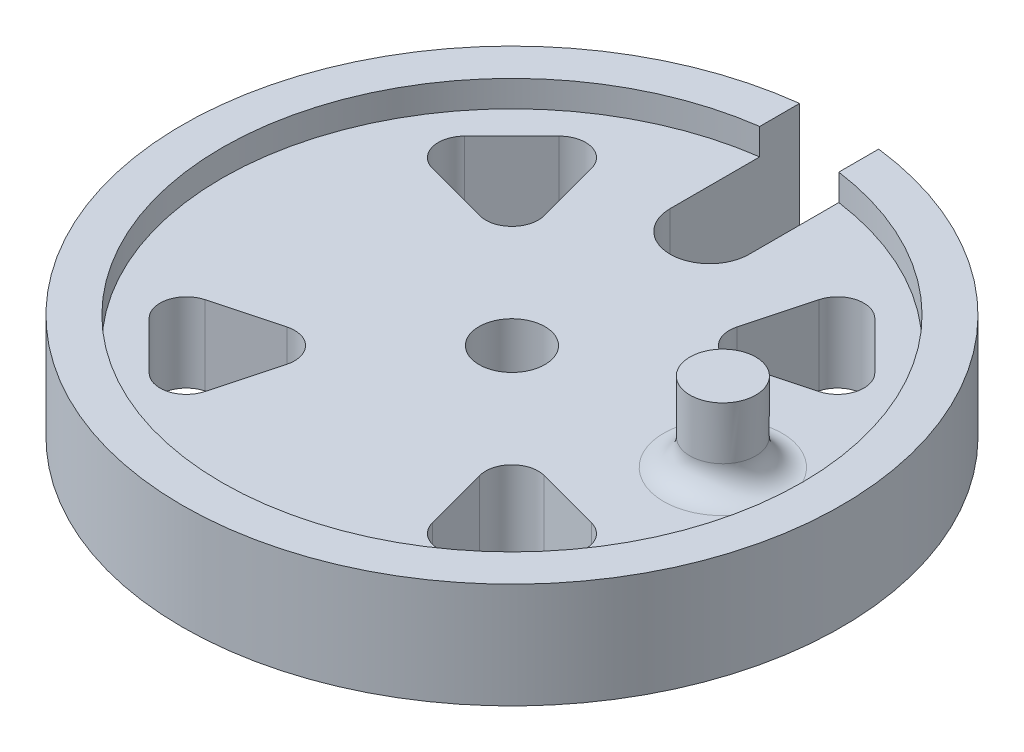
from build123d import *

# Parameters (mm, degrees)
SKETCH1_R           = 31.75
BOSS_EXTRUDE3_DEPTH = 10.16
SKETCH3_R           = 27.94
CUT_EXTRUDE1_DEPTH  = 2.54
SKETCH4_R           = 3.175
CUT_EXTRUDE2_DEPTH  = 46.543269536
CUT_EXTRUDE3_DEPTH  = 46.543269536
CUT_EXTRUDE4_DEPTH  = 46.543269536
FILLET1_R           = 2.54


with BuildPart() as part:
    # Sketch1 → Boss-Extrude3 (new body)
    with BuildSketch(Plane(origin=(0, 0, 0), x_dir=(1, 0, 0), z_dir=(0, 1, 0))):
        with Locations(Location((0, 0, 0), (0, 0, 270))):
            Circle(SKETCH1_R)
    extrude(amount=BOSS_EXTRUDE3_DEPTH)

    # Sketch3 → Cut-Extrude1 (cut)
    with BuildSketch(Plane(origin=(0, 10.16, 0), x_dir=(1, 0, 0), z_dir=(0, 1, 0))):
        with Locations(Location((0, 0, 0), (0, 0, 270))):
            Circle(SKETCH3_R)
    extrude(amount=-CUT_EXTRUDE1_DEPTH, mode=Mode.SUBTRACT)

    # Sketch4 → Cut-Extrude2 (cut, through all)
    with BuildSketch(Plane(origin=(0, 7.62, 0), x_dir=(1, 0, 0), z_dir=(0, 1, 0))):
        with Locations(Location((0, 0, 0), (0, 0, 270))):
            Circle(SKETCH4_R)
    extrude(amount=-CUT_EXTRUDE2_DEPTH, mode=Mode.SUBTRACT)

    # Sketch5 → Cut-Extrude3 (cut, through all)
    with BuildSketch(Plane(origin=(0, 7.62, 0), x_dir=(1, 0, 0), z_dir=(0, 1, 0))):
        with BuildLine():
            Line((12.39620867, 9.285356697), (18.617912617, 10.952457245))
            ThreePointArc((18.617912617, 10.952457245), (20.413963841, 12.748508469), (19.756563466, 15.201960068))
            Line((19.756563466, 15.201960068), (15.201960068, 19.756563466))
            ThreePointArc((15.201960068, 19.756563466), (12.748508469, 20.413963841), (10.952457245, 18.617912617))
            Line((10.952457245, 18.617912617), (9.285356697, 12.39620867))
            ThreePointArc((9.285356697, 12.39620867), (9.942757071, 9.942757071), (12.39620867, 9.285356697))
        make_face()
        with BuildLine():
            Line((9.285356697, -12.39620867), (10.952457245, -18.617912617))
            ThreePointArc((10.952457245, -18.617912617), (12.748508469, -20.413963841), (15.201960068, -19.756563466))
            Line((15.201960068, -19.756563466), (19.756563466, -15.201960068))
            ThreePointArc((19.756563466, -15.201960068), (20.413963841, -12.748508469), (18.617912617, -10.952457245))
            Line((18.617912617, -10.952457245), (12.39620867, -9.285356697))
            ThreePointArc((12.39620867, -9.285356697), (9.942757071, -9.942757071), (9.285356697, -12.39620867))
        make_face()
        with BuildLine():
            Line((-12.39620867, -9.285356697), (-18.617912617, -10.952457245))
            ThreePointArc((-18.617912617, -10.952457245), (-20.413963841, -12.748508469), (-19.756563466, -15.201960068))
            Line((-19.756563466, -15.201960068), (-15.201960068, -19.756563466))
            ThreePointArc((-15.201960068, -19.756563466), (-12.748508469, -20.413963841), (-10.952457245, -18.617912617))
            Line((-10.952457245, -18.617912617), (-9.285356697, -12.39620867))
            ThreePointArc((-9.285356697, -12.39620867), (-9.942757071, -9.942757071), (-12.39620867, -9.285356697))
        make_face()
        with BuildLine():
            Line((-9.285356697, 12.39620867), (-10.952457245, 18.617912617))
            ThreePointArc((-10.952457245, 18.617912617), (-12.748508469, 20.413963841), (-15.201960068, 19.756563466))
            Line((-15.201960068, 19.756563466), (-19.756563466, 15.201960068))
            ThreePointArc((-19.756563466, 15.201960068), (-20.413963841, 12.748508469), (-18.617912617, 10.952457245))
            Line((-18.617912617, 10.952457245), (-12.39620867, 9.285356697))
            ThreePointArc((-12.39620867, 9.285356697), (-9.942757071, 9.942757071), (-9.285356697, 12.39620867))
        make_face()
        with BuildLine():
            Line((-3.81, 19.05), (-3.81, 34.374285303))
            Line((-3.81, 34.374285303), (3.81, 34.374285303))
            Line((3.81, 34.374285303), (3.81, 19.05))
            ThreePointArc((3.81, 19.05), (0, 15.24), (-3.81, 19.05))
        make_face()
    extrude(amount=-CUT_EXTRUDE3_DEPTH, mode=Mode.SUBTRACT)

    # Sketch5<2> → Cut-Extrude4 (cut, through all)
    with BuildSketch(Plane(origin=(0, 7.62, 0), x_dir=(1, 0, 0), z_dir=(0, 1, 0))):
        with BuildLine():
            Line((12.39620867, 9.285356697), (18.617912617, 10.952457245))
            ThreePointArc((18.617912617, 10.952457245), (20.413963841, 12.748508469), (19.756563466, 15.201960068))
            Line((19.756563466, 15.201960068), (15.201960068, 19.756563466))
            ThreePointArc((15.201960068, 19.756563466), (12.748508469, 20.413963841), (10.952457245, 18.617912617))
            Line((10.952457245, 18.617912617), (9.285356697, 12.39620867))
            ThreePointArc((9.285356697, 12.39620867), (9.942757071, 9.942757071), (12.39620867, 9.285356697))
        make_face()
        with BuildLine():
            Line((9.285356697, -12.39620867), (10.952457245, -18.617912617))
            ThreePointArc((10.952457245, -18.617912617), (12.748508469, -20.413963841), (15.201960068, -19.756563466))
            Line((15.201960068, -19.756563466), (19.756563466, -15.201960068))
            ThreePointArc((19.756563466, -15.201960068), (20.413963841, -12.748508469), (18.617912617, -10.952457245))
            Line((18.617912617, -10.952457245), (12.39620867, -9.285356697))
            ThreePointArc((12.39620867, -9.285356697), (9.942757071, -9.942757071), (9.285356697, -12.39620867))
        make_face()
        with BuildLine():
            Line((-12.39620867, -9.285356697), (-18.617912617, -10.952457245))
            ThreePointArc((-18.617912617, -10.952457245), (-20.413963841, -12.748508469), (-19.756563466, -15.201960068))
            Line((-19.756563466, -15.201960068), (-15.201960068, -19.756563466))
            ThreePointArc((-15.201960068, -19.756563466), (-12.748508469, -20.413963841), (-10.952457245, -18.617912617))
            Line((-10.952457245, -18.617912617), (-9.285356697, -12.39620867))
            ThreePointArc((-9.285356697, -12.39620867), (-9.942757071, -9.942757071), (-12.39620867, -9.285356697))
        make_face()
        with BuildLine():
            Line((-9.285356697, 12.39620867), (-10.952457245, 18.617912617))
            ThreePointArc((-10.952457245, 18.617912617), (-12.748508469, 20.413963841), (-15.201960068, 19.756563466))
            Line((-15.201960068, 19.756563466), (-19.756563466, 15.201960068))
            ThreePointArc((-19.756563466, 15.201960068), (-20.413963841, 12.748508469), (-18.617912617, 10.952457245))
            Line((-18.617912617, 10.952457245), (-12.39620867, 9.285356697))
            ThreePointArc((-12.39620867, 9.285356697), (-9.942757071, 9.942757071), (-9.285356697, 12.39620867))
        make_face()
        with BuildLine():
            Line((-3.81, 19.05), (-3.81, 34.374285303))
            Line((-3.81, 34.374285303), (3.81, 34.374285303))
            Line((3.81, 34.374285303), (3.81, 19.05))
            ThreePointArc((3.81, 19.05), (0, 15.24), (-3.81, 19.05))
        make_face()
    extrude(amount=CUT_EXTRUDE4_DEPTH, mode=Mode.SUBTRACT)

    # Loft4: read off the stored shape, not the designer's step
    # Loft4: loft between two sections, ruled curve by curve
    loft4_from = [
        Edge.make_bspline([(21.644950372, 15.24, 2.885330399), (15.874289575, 15.24, 5.535231144), (13.22438883, 15.24, -0.235429654), (18.995049628, 15.24, -2.885330399), (24.765710425, 15.24, -5.535231144), (27.41561117, 15.24, 0.235429654), (21.644950372, 15.24, 2.885330399)], [0, 0, 0, 0, 0.5, 0.5, 0.5, 1, 1, 1, 1], 3, [1, 0.333333333, 0.333333333, 1, 0.333333333, 0.333333333, 1]),
    ]
    loft4_to = [
        Edge.make_bspline([(21.092187722, 7.62, 3.079667372), (14.932852978, 7.62, 4.624042816), (13.388477534, 7.62, -1.535291928), (19.547812278, 7.62, -3.079667372), (25.707147022, 7.62, -4.624042816), (27.251522466, 7.62, 1.535291928), (21.092187722, 7.62, 3.079667372)], [0, 0, 0, 0, 0.5, 0.5, 0.5, 1, 1, 1, 1], 3, [1, 0.333333333, 0.333333333, 1, 0.333333333, 0.333333333, 1]),
    ]
    loft4 = Solid(Shell([*[Face.make_surface_from_curves(loft4_from[k], loft4_to[k]) for k in range(1)], Face(Wire(loft4_from)), Face(Wire(loft4_to))]))
    add(loft4)

    # Fillet1
    fillet1_edges = [part.edges().sort_by_distance(p)[0] for p in [
        (19.547812278, 7.62, -3.079667372),
    ]]
    fillet(fillet1_edges, radius=FILLET1_R)


solid = part.part
